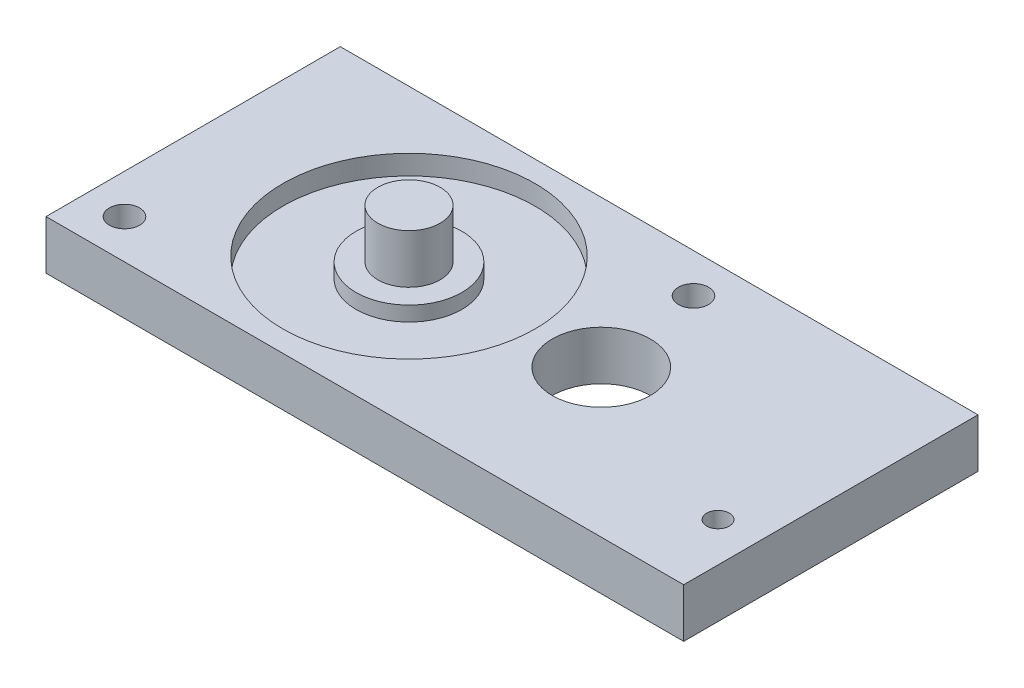
from build123d import *

# Parameters (mm, degrees)
SKETCH1_W           = 57
SKETCH1_H           = 30
BOSS_EXTRUDE1_DEPTH = 5
SKETCH2_R           = 3.175
BOSS_EXTRUDE2_DEPTH = 4.5
SKETCH3_R           = 1.5367
CUT_EXTRUDE1_DEPTH  = 5
SKETCH4_R           = 12.85
SKETCH4_R_2         = 5.4
CUT_EXTRUDE2_DEPTH  = 2
SKETCH5_R           = 5
CUT_EXTRUDE3_DEPTH  = 10
SKETCH6_W           = 8
SKETCH6_H           = 30
BOSS_EXTRUDE3_DEPTH = 5
SKETCH7_R           = 5.4
SKETCH7_R_2         = 3.175
CUT_EXTRUDE4_DEPTH  = 0.5
SKETCH8_R           = 1.15
CUT_EXTRUDE5_DEPTH  = 15


with BuildPart() as part:
    # Sketch1 → Boss-Extrude1 (new body)
    with BuildSketch(Plane(origin=(0, 0, 0), x_dir=(1, 0, 0), z_dir=(0, 1, 0))):
        with Locations((6.5, 0)):
            Rectangle(SKETCH1_W, SKETCH1_H)
    extrude(amount=BOSS_EXTRUDE1_DEPTH)

    # Sketch2 → Boss-Extrude2 (add)
    with BuildSketch(Plane(origin=(0, 5, 0), x_dir=(1, 0, 0), z_dir=(0, 1, 0))):
        Circle(SKETCH2_R)
    extrude(amount=BOSS_EXTRUDE2_DEPTH)

    # Sketch3 → Cut-Extrude1 (cut)
    with BuildSketch(Plane(origin=(0, 5, 0), x_dir=(1, 0, 0), z_dir=(0, 1, 0))):
        with Locations((-18, -11)):
            Circle(SKETCH3_R)
        with Locations((18, 11)):
            Circle(SKETCH3_R)
    extrude(amount=-CUT_EXTRUDE1_DEPTH, mode=Mode.SUBTRACT)

    # Sketch4 → Cut-Extrude2 (cut)
    with BuildSketch(Plane(origin=(0, 5, 0), x_dir=(1, 0, 0), z_dir=(0, 1, 0))):
        Circle(SKETCH4_R)
        Circle(SKETCH4_R_2, mode=Mode.SUBTRACT)
    extrude(amount=-CUT_EXTRUDE2_DEPTH, mode=Mode.SUBTRACT)

    # Sketch5 → Cut-Extrude3 (cut)
    with BuildSketch(Plane(origin=(0, 5, 0), x_dir=(1, 0, 0), z_dir=(0, 1, 0))):
        with Locations((19.6, 0)):
            Circle(SKETCH5_R)
    extrude(amount=-CUT_EXTRUDE3_DEPTH, mode=Mode.SUBTRACT)

    # Sketch6 → Boss-Extrude3 (add)
    with BuildSketch(Plane(origin=(0, 5, 0), x_dir=(1, 0, 0), z_dir=(0, 1, 0))):
        with Locations((39, 0)):
            Rectangle(SKETCH6_W, SKETCH6_H)
    extrude(amount=-BOSS_EXTRUDE3_DEPTH)

    # Sketch7 → Cut-Extrude4 (cut)
    with BuildSketch(Plane(origin=(0, 5, 0), x_dir=(1, 0, 0), z_dir=(0, 1, 0))):
        Circle(SKETCH7_R)
        Circle(SKETCH7_R_2, mode=Mode.SUBTRACT)
    extrude(amount=-CUT_EXTRUDE4_DEPTH, mode=Mode.SUBTRACT)

    # Sketch8 → Cut-Extrude5 (cut)
    with BuildSketch(Plane(origin=(0, 5, 0), x_dir=(1, 0, 0), z_dir=(0, 1, 0))):
        with Locations((39, -7.5)):
            Circle(SKETCH8_R)
    extrude(amount=-CUT_EXTRUDE5_DEPTH, mode=Mode.SUBTRACT)


solid = part.part
